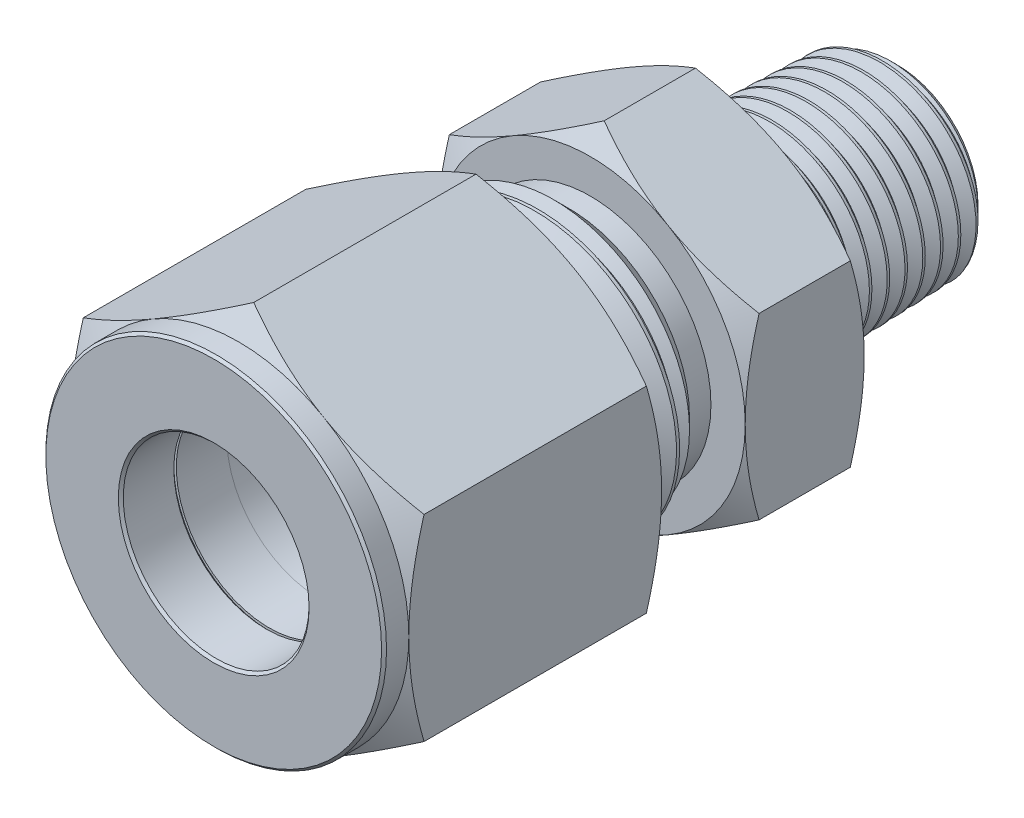
from build123d import *

# Parameters (mm, degrees)
BOSS_EXTRUDE1_DEPTH    = 14.224
CHAMFER1_SIZE          = 0.127
SKETCH4_W              = 18.034
SKETCH4_H              = 7.14375
CUT_SWEEP1_PITCH       = 1.27
BOSS_EXTRUDE2_DEPTH    = 6.096
CUT_SWEEP2_PITCH       = 0.941196605
CUT_SWEEP2_HEIGHT      = 10.907700741
CUT_SWEEP2_RADIUS      = 4.833177772
CUT_SWEEP2_START_ANGLE = 90


with BuildPart() as part:
    # Sketch2 → Boss-Extrude1 (new body)
    with BuildSketch(Plane.XY):
        Polygon((0, 10.081979076), (-8.73125, 5.040989538), (-8.73125, -5.040989538), (0, -10.081979076), (8.73125, -5.040989538), (8.73125, 5.040989538), align=None)
    extrude(amount=-BOSS_EXTRUDE1_DEPTH)

    # Sketch3 → Cut-Revolve1 (revolve, cut)
    with BuildSketch(Plane(origin=(0, 0, 0), x_dir=(0, 0, -1), z_dir=(1, 0, 0)), mode=Mode.PRIVATE) as cut_revolve1_sk:
        Polygon((0, 10.081979076), (0, 8.73125), (1.27, 8.73125), (2.049843795, 10.081979076), (13.444156205, 10.081979076), (14.224, 8.73125), (14.224, 10.081979076), (14.224, 11.432708151), (0, 11.432708151), align=None)
        Polygon((0, 4.7625), (0, 0), (14.224, 0), (14.224, 7.14375), (5.6896, 7.14375), (5.6896, 6.50875), (2.8448, 6.50875), (2.8448, 5.87375), (2.8448, 4.7625), align=None)
    revolve(cut_revolve1_sk.sketch.rotate(Axis((0, 0, 0), (0, 0, -1)), 90), axis=Axis((0, 0, 0), (0, 0, -1)), mode=Mode.SUBTRACT)

    # Chamfer1
    chamfer1_edges = [part.edges().sort_by_distance(p)[0] for p in [
        (-8.73125, 0, 0),
        (-4.7625, 0, -2.8448),
        (-4.7625, 0, 0),
    ]]
    chamfer(chamfer1_edges, length=CHAMFER1_SIZE)


with BuildPart() as body_2:
    # Sketch4 → Revolve1 (revolve)
    with BuildSketch(Plane(origin=(0, 0, 0), x_dir=(0, 0, -1), z_dir=(1, 0, 0)), mode=Mode.PRIVATE) as revolve1_sk:
        with Locations((16.383, 3.571875)):
            Rectangle(SKETCH4_W, SKETCH4_H)
    revolve(revolve1_sk.sketch.rotate(Axis((0, 0, -25.4), (0, 0, 1)), 90), axis=Axis((0, 0, -25.4), (0, 0, 1)))

    # Cut-Sweep1: the profile of Sketch6 screwed along a right-hand helix of 15.2 turns, 8 arcs to a turn; built about Z, then put on its axis
    cut_sweep1_z = Axis((0, 0, 0), (0, 0, 1))
    cut_sweep1_corners = [(6.318860803, 0, -0.635), (7.212490766, 0, -1.1509375), (7.212490766, 0, 0.0396875), (6.318860803, 0, -0.47625)]
    with BuildLine(mode=Mode.PRIVATE) as cut_sweep1_profile:
        Line(cut_sweep1_corners[0], cut_sweep1_corners[1])
        Line(cut_sweep1_corners[1], cut_sweep1_corners[2])
        Line(cut_sweep1_corners[2], cut_sweep1_corners[3])
        Line(cut_sweep1_corners[3], cut_sweep1_corners[0])
    cut_sweep1_cap = Face(cut_sweep1_profile.wire())
    cut_sweep1_turn_angles = [0, 22.5, 45, 67.5, 90, 112.5, 135, 157.5, 180, 202.5, 225, 247.5, 270, 292.5, 315, 337.5, 360]
    cut_sweep1_turn_weights = [1, 0.9238795325112867, 1, 0.9238795325112867, 1, 0.9238795325112867, 1, 0.9238795325112867, 1, 0.9238795325112867, 1, 0.9238795325112867, 1, 0.9238795325112867, 1, 0.9238795325112867, 1]
    cut_sweep1_turn_rails = [Edge.make_bspline([Vector(p[0], p[1], 0).rotate(cut_sweep1_z, cut_sweep1_turn_angles[k]) / cut_sweep1_turn_weights[k] + Vector(0, 0, p[2] + CUT_SWEEP1_PITCH * cut_sweep1_turn_angles[k] / 360) for k in range(17)], [0, 0, 0, 1, 1, 2, 2, 3, 3, 4, 4, 5, 5, 6, 6, 7, 7, 8, 8, 8], 2, cut_sweep1_turn_weights) for p in cut_sweep1_corners]
    cut_sweep1_turn_sides = [Face.make_surface_from_curves(cut_sweep1_turn_rails[p[0]], cut_sweep1_turn_rails[p[1]]) for p in [(0, 1), (1, 2), (2, 3), (3, 0)]]
    cut_sweep1_last_angles = [5400, 5422.5, 5445, 5458.5, 5472]
    cut_sweep1_last_weights = [1, 0.9238795325112867, 1, 0.9723699203976488, 1]
    cut_sweep1_last_rails = [Edge.make_bspline([Vector(p[0], p[1], 0).rotate(cut_sweep1_z, cut_sweep1_last_angles[k]) / cut_sweep1_last_weights[k] + Vector(0, 0, p[2] + CUT_SWEEP1_PITCH * cut_sweep1_last_angles[k] / 360) for k in range(5)], [0, 0, 0, 1, 1, 2, 2, 2], 2, cut_sweep1_last_weights) for p in cut_sweep1_corners]
    cut_sweep1_last_sides = [Face.make_surface_from_curves(cut_sweep1_last_rails[p[0]], cut_sweep1_last_rails[p[1]]) for p in [(0, 1), (1, 2), (2, 3), (3, 0)]]
    cut_sweep1 = Plane(origin=(0, 0, -7.366), x_dir=(0, 1, 0), z_dir=(0, 0, -1)) * Solid(Shell([*[p.moved(Location((0, 0, CUT_SWEEP1_PITCH * i))) for i in range(15) for p in cut_sweep1_turn_sides], *cut_sweep1_last_sides, cut_sweep1_cap, cut_sweep1_cap.rotate(cut_sweep1_z, 5472).moved(Location((0, 0, CUT_SWEEP1_PITCH * 5472 / 360)))]))
    add(cut_sweep1, mode=Mode.SUBTRACT)

    # Sketch7 → Boss-Extrude2 (add)
    with BuildSketch(Plane(origin=(0, 0, -25.4), x_dir=(-1, 0, 0), z_dir=(0, 0, -1))):
        Polygon((0, 9.165435523), (-7.9375, 4.582717762), (-7.9375, -4.582717762), (0, -9.165435523), (7.9375, -4.582717762), (7.9375, 4.582717762), align=None)
    extrude(amount=-BOSS_EXTRUDE2_DEPTH)

    # Sketch8 → Cut-Revolve2 (revolve, cut)
    with BuildSketch(Plane(origin=(0, 0, 0), x_dir=(0, 0, -1), z_dir=(1, 0, 0)), mode=Mode.PRIVATE) as cut_revolve2_sk:
        Polygon((7.366, 7.281231533), (7.366, 6.18137927), (8.465852263, 7.281231533), align=None)
        Polygon((19.304, 7.281231533), (17.104295474, 7.281231533), (18.204147737, 6.18137927), (19.304, 6.18137927), align=None)
        Polygon((19.304, 7.9375), (20.012948905, 9.165435523), (24.691051095, 9.165435523), (25.4, 7.9375), (25.4, 9.165435523), (25.4, 10.393371047), (19.304, 10.393371047), (19.304, 9.165435523), align=None)
        Polygon((17.018, 3.5687), (25.4, 3.5687), (25.4, 0), (7.366, 0), (7.366, 5.642404948), (10.922668421, 4.7625), (17.018, 4.7625), align=None)
    revolve(cut_revolve2_sk.sketch.rotate(Axis((0, 0, 0), (0, 0, -1)), 90), axis=Axis((0, 0, 0), (0, 0, -1)), mode=Mode.SUBTRACT)


with BuildPart() as body_3:
    # Sketch9 → Revolve2 (revolve)
    with BuildSketch(Plane(origin=(0, 0, 0), x_dir=(0, 0, -1), z_dir=(1, 0, 0)), mode=Mode.PRIVATE) as revolve2_sk:
        Polygon((4.7625, 6.2865), (4.7625, 5.4356), (5.4356, 4.7625), (9.6393, 4.7625), (9.6393, 5.08), align=None)
    revolve(revolve2_sk.sketch.rotate(Axis((0, 0, 0), (0, 0, -1)), 90), axis=Axis((0, 0, 0), (0, 0, -1)))


with BuildPart() as body_4:
    # Sketch10 → Revolve3 (revolve)
    with BuildSketch(Plane(origin=(0, 0, 0), x_dir=(0, 0, -1), z_dir=(1, 0, 0)), mode=Mode.PRIVATE) as revolve3_sk:
        Polygon((2.8448, 6.223), (3.9878, 6.223), (3.9878, 5.4356), (4.7625, 5.4356), (5.4356, 4.7625), (2.8448, 4.7625), align=None)
    revolve(revolve3_sk.sketch.rotate(Axis((0, 0, 0), (0, 0, -1)), 90), axis=Axis((0, 0, 0), (0, 0, -1)))


with BuildPart() as body_5:
    # Sketch11 → Revolve4 (revolve)
    with BuildSketch(Plane(origin=(0, 0, 0), x_dir=(0, 0, -1), z_dir=(1, 0, 0)), mode=Mode.PRIVATE) as revolve4_sk:
        Polygon((25.08504, 0), (35.052, 0), (35.052, 4.833177772), (25.08504, 5.1435), align=None)
    revolve(revolve4_sk.sketch.rotate(Axis((0, 0, -25.08504), (0, 0, -1)), 90), axis=Axis((0, 0, -25.08504), (0, 0, -1)))

    # Cut-Sweep2: sweep along a helix
    with BuildLine() as cut_sweep2_path:
        # a taper helix: rise per turn along the axis 0.940740741, along the cone's slant (build123d's pitch) 0.941196605
        add(Helix(CUT_SWEEP2_PITCH, CUT_SWEEP2_HEIGHT, CUT_SWEEP2_RADIUS, center=(0, 0, -35.052), direction=(0, 0, 1), cone_angle=1.783333333, mode=Mode.PRIVATE).rotate(Axis((0, 0, -35.052), (0, 0, 1)), CUT_SWEEP2_START_ANGLE))
    # Sketch13 → Cut-Sweep2 (sweep, cut)
    with BuildSketch(Plane(origin=(0, 0, 0), x_dir=(0, 0, -1), z_dir=(1, 0, 0))):
        Polygon((34.993203704, 4.935015945), (35.904546296, 4.884096858), (35.52237037, 4.222148737), (35.404777778, 4.222148737), align=None)
    sweep(path=cut_sweep2_path.line, is_frenet=True, mode=Mode.SUBTRACT)


with BuildPart() as body_2_1:
    add(body_2.part)

    # Combine1: union body 5
    add(body_5.part)

    # Sketch14 → Cut-Revolve4 (revolve, cut)
    with BuildSketch(Plane(origin=(0, 0, 0), x_dir=(0, 0, -1), z_dir=(1, 0, 0)), mode=Mode.PRIVATE) as cut_revolve4_sk:
        Polygon((35.052, 4.120310565), (34.23729462, 4.935015945), (35.052, 4.935015945), align=None)
        Polygon((35.052, 3.5687), (25.08504, 3.5687), (22.940748709, 0), (35.052, 0), align=None)
    revolve(cut_revolve4_sk.sketch.rotate(Axis((0, 0, 0), (0, 0, -1)), 90), axis=Axis((0, 0, 0), (0, 0, -1)), mode=Mode.SUBTRACT)


solid = Compound([part.part, body_3.part, body_4.part, body_2_1.part])
